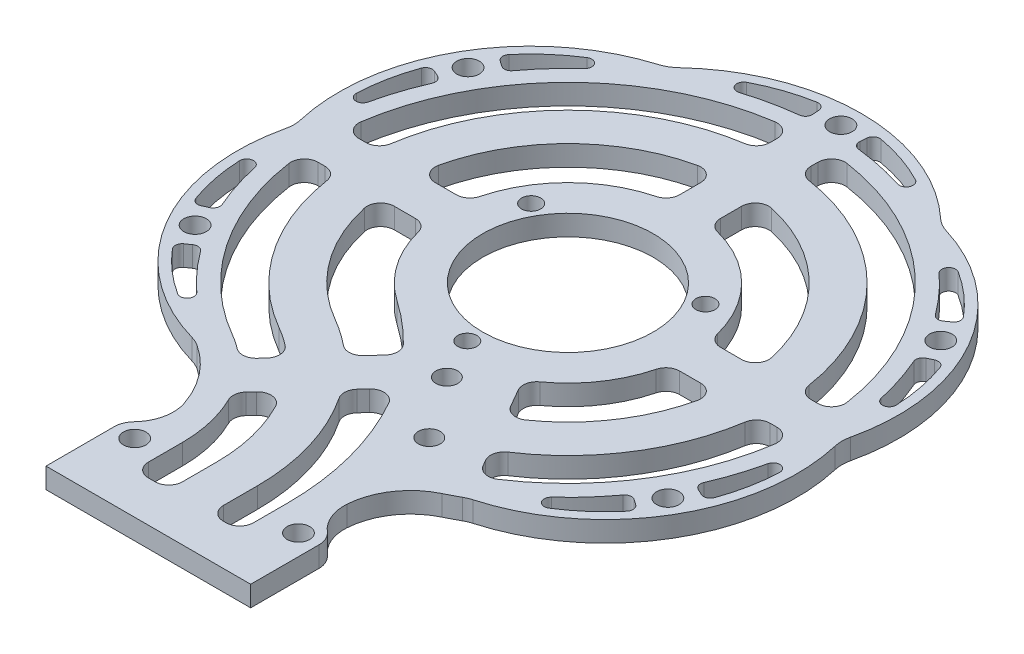
from build123d import *

# Parameters (mm, degrees)
SWEEP_2_DEPTH                   = 3
SKETCH_15_W                     = 3
SKETCH_15_H                     = 8
REVOLVE_1_ANGLE                 = 60
SKETCH_20_R                     = 26.546275206
EXTRUDE_1_DEPTH                 = 3
SKETCH_21_R                     = 12.5
CUT_EXTRUDE_1_DEPTH             = 10
CUT_EXTRUDE_2_REACH             = 65.063
SKETCH_22_R                     = 20
EXTRUDE_START                   = 22
SKETCH_23_R                     = 17
SKETCH_23_R_2                   = 12.5
EXTRUDE_2_DEPTH                 = 22
SKETCH_24_R                     = 55.165528931
CUT_EXTRUDE_3_DEPTH             = 67.603303222
SKETCH_25_R                     = 1.4
CUT_EXTRUDE_4_DEPTH             = 10
SKETCH_26_R                     = 3
EXTRUDE_3_DEPTH                 = 3
SKETCH_27_R                     = 1.4
CUT_EXTRUDE_5_DEPTH             = 3
FILLET_1_R                      = 10
SKETCH_28_R                     = 1.6
CUT_EXTRUDE_6_DEPTH             = 132.370246405
SKETCH_29_W                     = 24
SKETCH_29_H                     = 3
EXTRUDE_4_DEPTH                 = 13
SKETCH_30_R                     = 3
EXTRUDE_5_DEPTH                 = 3
SKETCH_31_R                     = 1.35
CUT_EXTRUDE_7_DEPTH             = 15
FILLET_2_R                      = 6
CUT_EXTRUDE_9_DEPTH             = 10
EXTRUDE_6_DEPTH                 = 3
SKETCH_35_W                     = 6
SKETCH_35_H                     = 18.865237243
EXTRUDE_8_DEPTH                 = 3
SKETCH_36_W                     = 21.70105557
SKETCH_36_H                     = 6
EXTRUDE_9_DEPTH                 = 3
FILLET_3_R                      = 2
FILLET_4_R                      = 2
FILLET_5_R                      = 2
EXTRUDE_10_DEPTH                = 3
FILLET_6_R                      = 2
EXTRUDE_11_DEPTH                = 3
CUT_EXTRUDE_START               = -10
CUT_EXTRUDE_10_DEPTH            = 10
EXTRUDE_START_2                 = -3
EXTRUDE_12_DEPTH                = 3
PATTERN_CIRCULAR_1_COUNT        = 3
PATTERN_CIRCULAR_1_ANGLE        = 120
PATTERN_START                   = -3
PATTERN_CIRCULAR_1_COPY_1_DEPTH = 3
PATTERN_CIRCULAR_1_COPY_2_DEPTH = 3
F_1_THE_OTHER_WAY_COUNT         = 3
F_1_THE_OTHER_WAY_ANGLE         = 120
F_1_START                       = -3
F_1_THE_OTHER_WAY_COPY_1_DEPTH  = 3
F_1_THE_OTHER_WAY_COPY_2_DEPTH  = 3
EXTRUDE_13_DEPTH                = 3
FILLET_8_R                      = 5
FILLET_9_R                      = 5
MM_PRESS_1_D                    = 3.3


# Read off the part's stored shape, not the designer's step: 扫描2
with BuildPart() as part:
    # 扫描2 outline → 扫描2 (new body)
    with BuildSketch(Plane(origin=(0, 0, 0), x_dir=(1, 0, 0), z_dir=(0, 1, 0))):
        with BuildLine():
            ThreePointArc((-20, -34.641016151), (-14.143593539, -40.497422612), (-12, -48.497422612))
            Line((-12, -48.497422612), (12, -48.497422612))
            ThreePointArc((12, -48.497422612), (11.683405538, -43.474741562), (10.738633754, -38.531568163))
            ThreePointArc((10.738633754, -38.531568163), (5.02268105, 39.683405538), (-20, -34.641016151))
        make_face()
        with BuildLine():
            ThreePointArc((0, -19.931708898), (-3.808527847, -16.641925832), (-8, -13.856406461))
            ThreePointArc((-8, -13.856406461), (4.14110472, 15.454813221), (0, -16))
            Line((0, -16), (0, -19.931708898))
        make_face(mode=Mode.SUBTRACT)
    extrude(amount=SWEEP_2_DEPTH)

    # 扫描3: sweep along a path in 草图16
    with BuildLine(Plane(origin=(0, 3, 0), x_dir=(1, 0, 0), z_dir=(0, 1, 0))) as sweep_3_path:
        ThreePointArc((-12, -48.497422612), (-14.143593539, -40.497422612), (-20, -34.641016151))
        ThreePointArc((-20, -34.641016151), (5.02268105, 39.683405538), (10.738633754, -38.531568163))
    # 草图15 → 扫描3 (sweep)
    with BuildSketch(Plane.XY.offset(48.497422612)):
        with Locations((-10.5, 4)):
            Rectangle(SKETCH_15_W, SKETCH_15_H)
    sweep(path=sweep_3_path.line)

    # 草图17 → 旋转1 (revolve)
    with BuildSketch(Plane.XY.offset(48.497422612)):
        Polygon((9, 8), (9, 0), (12, 0), (12, 3), (15, 3), (15, 8), align=None)
    revolve(axis=Axis((-28, 3, 48.497422612), (0, 1, 0)), revolution_arc=REVOLVE_1_ANGLE)

    # 草图20 → 凸台-拉伸1 (add)
    with BuildSketch(Plane(origin=(0, 3, 0), x_dir=(1, 0, 0), z_dir=(0, 1, 0))):
        Circle(SKETCH_20_R)
    extrude(amount=-EXTRUDE_1_DEPTH)

    # 草图21 → 切除-拉伸1 (cut)
    with BuildSketch(Plane(origin=(0, 3, 0), x_dir=(1, 0, 0), z_dir=(0, 1, 0))):
        with Locations(Location((0, 0, 0), (0, 0, 270))):
            Circle(SKETCH_21_R)
    extrude(amount=-CUT_EXTRUDE_1_DEPTH, mode=Mode.SUBTRACT)

    # 草图22 → 切除-拉伸2 (cut, up to next)
    with BuildSketch(Plane(origin=(0, 3, 0), x_dir=(1, 0, 0), z_dir=(0, 1, 0)), mode=Mode.PRIVATE) as cut_extrude_2_sk1:
        Circle(SKETCH_22_R)
    cut_extrude_2_tool1 = extrude(cut_extrude_2_sk1.sketch, amount=CUT_EXTRUDE_2_REACH, mode=Mode.PRIVATE) & part.part
    add(cut_extrude_2_tool1.solids().sort_by_distance((0, 3, 0))[0], mode=Mode.SUBTRACT)

    # 草图23 → 凸台-拉伸2 (add)
    with BuildSketch(Plane(origin=(0, 3, 0), x_dir=(1, 0, 0), z_dir=(0, 1, 0)).offset(EXTRUDE_START)):
        with Locations(Location((0, 0, 0), (0, 0, 270))):
            Circle(SKETCH_23_R)
        with Locations(Location((0, 0, 0), (0, 0, 270))):
            Circle(SKETCH_23_R_2, mode=Mode.SUBTRACT)
    extrude(amount=-EXTRUDE_2_DEPTH)

    # 草图24 → 切除-拉伸3 (cut, through all)
    with BuildSketch(Plane(origin=(0, 3, 0), x_dir=(1, 0, 0), z_dir=(0, 1, 0))):
        Circle(SKETCH_24_R)
    extrude(amount=CUT_EXTRUDE_3_DEPTH, mode=Mode.SUBTRACT)

    # 草图25 → 切除-拉伸4 (cut)
    with BuildSketch(Plane(origin=(0, 3, 0), x_dir=(1, 0, 0), z_dir=(0, 1, 0))):
        with Locations(Location((0, -14.75, 0), (0, 0, 270))):
            Circle(SKETCH_25_R)
        with Locations(Location((-12.773874706, 7.375, 0), (0, 0, 270))):
            Circle(SKETCH_25_R)
        with Locations(Location((12.773874706, 7.375, 0), (0, 0, 270))):
            Circle(SKETCH_25_R)
    extrude(amount=-CUT_EXTRUDE_4_DEPTH, mode=Mode.SUBTRACT)

    # 草图26 → 凸台-拉伸3 (add)
    with BuildSketch(Plane(origin=(0, 3, 0), x_dir=(1, 0, 0), z_dir=(0, 1, 0))):
        with Locations((0, 40)):
            Circle(SKETCH_26_R)
        with Locations((34.641016151, 20)):
            Circle(SKETCH_26_R)
        with Locations((34.641016151, -20)):
            Circle(SKETCH_26_R)
        with Locations((0, -40)):
            Circle(SKETCH_26_R)
        with Locations((-34.641016151, -20)):
            Circle(SKETCH_26_R)
        with Locations((-34.641016151, 20)):
            Circle(SKETCH_26_R)
    extrude(amount=-EXTRUDE_3_DEPTH)

    # 草图27 → 切除-拉伸5 (cut)
    with BuildSketch(Plane(origin=(0, 3, 0), x_dir=(1, 0, 0), z_dir=(0, 1, 0))):
        with Locations(Location((0, 40, 0), (0, 0, 270))):
            Circle(SKETCH_27_R)
        with Locations(Location((34.641016151, 20, 0), (0, 0, 270))):
            Circle(SKETCH_27_R)
        with Locations(Location((34.641016151, -20, 0), (0, 0, 270))):
            Circle(SKETCH_27_R)
        with Locations(Location((-34.641016151, -20, 0), (0, 0, 270))):
            Circle(SKETCH_27_R)
        with Locations(Location((-34.641016151, 20, 0), (0, 0, 270))):
            Circle(SKETCH_27_R)
    extrude(amount=-CUT_EXTRUDE_5_DEPTH, mode=Mode.SUBTRACT)

    # 圆角1
    fillet_1_edges = [part.edges().sort_by_distance(p)[0] for p in [
        (10.738633754, 1.5, 38.531568163),
    ]]
    fillet(fillet_1_edges, radius=FILLET_1_R)

    # 草图28 → 切除-拉伸6 (cut, through all)
    with BuildSketch(Plane(origin=(81.194664378, 11, -0.989898296), x_dir=(0.3228039028312254, 0, 0.9464658685430388), z_dir=(0, 1, 0))):
        with Locations(Location((5.99382266, -77.812125081, 0), (0, 0, 341.167421925))):
            Circle(SKETCH_28_R)
        with Locations(Location((-4.545358519, -80.962626641, 0), (0, 0, 341.167421925))):
            Circle(SKETCH_28_R)
    extrude(amount=-CUT_EXTRUDE_6_DEPTH, mode=Mode.SUBTRACT)

    # 草图29 → 凸台-拉伸4 (add)
    with BuildSketch(Plane.XY.offset(48.497422612)):
        with Locations((0, 1.5)):
            Rectangle(SKETCH_29_W, SKETCH_29_H)
    extrude(amount=EXTRUDE_4_DEPTH)

    # 草图30 → 凸台-拉伸5 (add)
    with BuildSketch(Plane(origin=(0, 3, 0), x_dir=(1, 0, 0), z_dir=(0, 1, 0))):
        with Locations((12, -51.497422612)):
            Circle(SKETCH_30_R)
        with BuildLine():
            ThreePointArc((-12, -54.497422612), (-9.878679656, -53.618742955), (-9, -51.497422612))
            ThreePointArc((-9, -51.497422612), (-9.878679656, -49.376102268), (-12, -48.497422612))
            Line((-12, -48.497422612), (-12, -54.497422612))
        make_face()
        with BuildLine():
            Line((-12, -54.497422612), (-12, -48.497422612))
            ThreePointArc((-12, -48.497422612), (-15, -51.497422612), (-12, -54.497422612))
        make_face()
        with BuildLine():
            ThreePointArc((12, -54.497422612), (14.121320344, -53.618742955), (15, -51.497422612))
            ThreePointArc((15, -51.497422612), (14.121320344, -49.376102268), (12, -48.497422612))
            Line((12, -48.497422612), (12, -54.497422612))
        make_face()
        with BuildLine():
            Line((12, -54.497422612), (12, -48.497422612))
            ThreePointArc((12, -48.497422612), (9, -51.497422612), (12, -54.497422612))
        make_face()
    extrude(amount=-EXTRUDE_5_DEPTH)

    # 草图31 → 切除-拉伸7 (cut)
    with BuildSketch(Plane.XZ):
        with Locations(Location((-12, 51.497422612, 0), (0, 0, 270))):
            Circle(SKETCH_31_R)
        with Locations(Location((12, 51.497422612, 0), (0, 0, 270))):
            Circle(SKETCH_31_R)
    extrude(amount=-CUT_EXTRUDE_7_DEPTH, mode=Mode.SUBTRACT)

    # 圆角2
    # the kernel refuses this fillet: 6 mm, written as the material it adds along each edge
    with BuildSketch(Plane(origin=(-12, 0, 48.497422612), x_dir=(-0.9188891205468253, 0, 0.3945158857900176), z_dir=(0, 1, 0))) as fillet_2_piece_1:
        with BuildLine():
            CenterArc((4.73419063, -5.513334723), FILLET_2_R, 113.235784524, 62.181860715)
            ThreePointArc((-1.246630549, -5.033983053), (-0.828629151, -2.466146987), (0, 0))
            ThreePointArc((0, 0), (1.183547657, -0.243332638), (2.367095315, 0))
        make_face()
    extrude(amount=3)
    with BuildSketch(Plane(origin=(33.044643352, 3, -22.539998797), x_dir=(0.9763333982602803, 0, -0.21627088440549028), z_dir=(0, -1, 0)), Plane(origin=(36.042533235, 3, 17.347501204), x_dir=(0.6754627791459785, 0, 0.7373940832339184), z_dir=(0, -1, 0))) as fillet_2_piece_2:
        with BuildLine():
            CenterArc((4.037057174, -5.650269228), FILLET_2_R, 109.658997639, 43.86169752)
            ThreePointArc((-1.333515642, -2.975022018), (-0.636435164, -1.501102753), (0, 0))
            ThreePointArc((0, 0), (1.009264294, -0.174865386), (2.018528587, 0))
        make_face()
    extrude(amount=3)
    with BuildSketch(Plane(origin=(36.042533235, 3, -17.347501204), x_dir=(0.3966064660544948, 0, 0.9179887314579438), z_dir=(0, -1, 0)), Plane(origin=(33.044643352, 3, 22.539998797), x_dir=(-0.5966983288141339, 0, 0.8024656406291921), z_dir=(0, -1, 0)), Plane(origin=(2.997889883, 3, -39.8875), x_dir=(0.9933047948584526, 0, 0.11552309081394699), z_dir=(0, -1, 0))) as fillet_2_piece_3:
        with BuildLine():
            CenterArc((3.504734114, -5.995015577), FILLET_2_R, 92.335605783, 43.86169752)
            ThreePointArc((-0.825631791, -1.841952715), (-0.253247299, -0.992500944), (0, 0))
            ThreePointArc((0, 0), (1.63010889, -0.03322949), (3.26021778, 0))
        make_face()
    extrude(amount=3)
    with BuildSketch(Plane(origin=(-2.997889883, 3, -39.8875), x_dir=(0.30087061904832696, 0, -0.9536649676870157), z_dir=(0, -1, 0))) as fillet_2_piece_4:
        with BuildLine():
            CenterArc((4.037057174, -5.650269227), FILLET_2_R, 109.65899764, 43.861697522)
            ThreePointArc((-1.333515641, -2.975022018), (-0.636435164, -1.501102753), (0, 0))
            ThreePointArc((0, 0), (1.009264294, -0.174865386), (2.018528587, 0))
        make_face()
    extrude(amount=3)
    with BuildSketch(Plane(origin=(-36.042533235, 3, -17.347501204), x_dir=(-0.3966064660363216, 0, 0.9179887314657953), z_dir=(0, -1, 0))) as fillet_2_piece_5:
        with BuildLine():
            CenterArc((3.504734114, 5.995015577), FILLET_2_R, 223.80269669, 43.861697526)
            ThreePointArc((-0.82563179, 1.841952715), (-0.253247299, 0.992500944), (0, 0))
            ThreePointArc((0, 0), (1.63010889, 0.03322949), (3.260217781, 0))
        make_face()
    extrude(amount=3)
    with BuildSketch(Plane(origin=(-33.044643352, 3, -22.539998796), x_dir=(-0.9763333982183507, 0, -0.2162708845947773), z_dir=(0, -1, 0))) as fillet_2_piece_6:
        with BuildLine():
            CenterArc((4.037057175, 5.650269227), FILLET_2_R, 206.479304831, 43.861697526)
            ThreePointArc((-1.333515641, 2.975022019), (-0.636435164, 1.501102753), (0, 0))
            ThreePointArc((0, 0), (1.009264294, 0.174865386), (2.018528587, 0))
        make_face()
    extrude(amount=3)
    with BuildSketch(Plane(origin=(-33.044643352, 3, 22.539998796), x_dir=(0.5966983288105701, 0, 0.8024656406318421), z_dir=(0, -1, 0))) as fillet_2_piece_7:
        with BuildLine():
            CenterArc((3.504734114, 5.995015577), FILLET_2_R, 223.802696689, 43.861697528)
            ThreePointArc((-0.82563179, 1.841952715), (-0.253247299, 0.992500944), (0, 0))
            ThreePointArc((0, 0), (1.63010889, 0.03322949), (3.260217781, 0))
        make_face()
    extrude(amount=3)
    with BuildSketch(Plane(origin=(-36.042533235, 3, 17.347501203), x_dir=(-0.6754627793068153, 0, 0.7373940830865899), z_dir=(0, -1, 0))) as fillet_2_piece_8:
        with BuildLine():
            CenterArc((4.037057175, 5.650269227), FILLET_2_R, 206.479304829, 43.861697528)
            ThreePointArc((-1.333515641, 2.975022019), (-0.636435164, 1.501102753), (0, 0))
            ThreePointArc((0, 0), (1.009264294, 0.174865386), (2.018528588, 0))
        make_face()
    extrude(amount=3)
    with BuildSketch(Plane(origin=(-12, 3, 54.497422612), x_dir=(0, 0, 1), z_dir=(0, -1, 0)), Plane(origin=(12, 0, 54.497422612), x_dir=(0, 0, 1), z_dir=(0, 1, 0))) as fillet_2_piece_9:
        with BuildLine():
            CenterArc((3.708203932, 6), FILLET_2_R, 221.810314896, 48.189685104)
            ThreePointArc((-0.763932023, 2), (-0.197482923, 1.070466269), (0, 0))
            Line((0, 0), (3.708203932, 0))
        make_face()
    extrude(amount=3)
    with BuildSketch(Plane(origin=(12, 0, 48.497422612), x_dir=(0.9371957750043066, 0, 0.3488037833998896), z_dir=(0, 1, 0))) as fillet_2_piece_10:
        with BuildLine():
            CenterArc((4.185645401, 5.62317465), FILLET_2_R, 196.491348694, 53.09448469)
            Line((-1.56753025, 3.919951256), (-2.142847815, 3.749628917))
            ThreePointArc((-2.142847815, 3.749628917), (-1.626796654, 2.367965564), (-0.562317465, -0.20928227))
            Line((-0.562317465, -0.20928227), (0.20928227, -0.562317465))
            ThreePointArc((0.20928227, -0.562317465), (1.04641135, -0.411587325), (1.88354043, -0.562317465))
            Line((1.88354043, -0.562317465), (2.092822701, 0))
        make_face()
    extrude(amount=3)

    # 草图32 → 切除-拉伸9 (cut)
    with BuildSketch(Plane.XZ):
        with BuildLine():
            Line((-8, 61.497422612), (-8, 48.497422612))
            ThreePointArc((-8, 48.497422612), (-10.679492111, 38.497422289), (-18.000000645, 31.176914164))
            ThreePointArc((-18.000000645, 31.176914164), (3.72e-07, -36), (18, 31.176914536))
            Line((18, 31.176914536), (15.5, 26.846787517))
            ThreePointArc((15.5, 26.846787517), (-2.81e-07, -31), (-15.499999514, 26.846787798))
            ThreePointArc((-15.499999514, 26.846787798), (-6.349364765, 35.997422855), (-3, 48.497422612))
            Line((-3, 48.497422612), (-3, 61.497422612))
            Line((-3, 61.497422612), (-8, 61.497422612))
        make_face()
        with BuildLine():
            Line((3, 61.497422612), (3, 48.497422612))
            ThreePointArc((3, 48.497422612), (-1.153212653, 32.997422318), (-12.500000589, 21.650634755))
            ThreePointArc((-12.500000589, 21.650634755), (3.4e-07, -25), (12.5, 21.650635095))
            Line((12.5, 21.650635095), (9, 15.588457268))
            ThreePointArc((9, 15.588457268), (0.739708837, -17.984794434), (-10.249732693, 14.796721925))
            ThreePointArc((-10.249732693, 14.796721925), (-3.462921106, 20.698035366), (1.87377597, 27.937232569))
            ThreePointArc((1.87377597, 27.937232569), (5.995910609, 37.85219006), (7.40211114, 48.497422612))
            Line((7.40211114, 48.497422612), (7.40211114, 61.497422612))
            Line((7.40211114, 61.497422612), (3, 61.497422612))
        make_face()
    extrude(amount=-CUT_EXTRUDE_9_DEPTH, mode=Mode.SUBTRACT)

    # 草图33 → 凸台-拉伸6 (add)
    with BuildSketch(Plane.XZ):
        with BuildLine():
            Line((39.88734135, 3), (17.499825783, 3))
            Line((17.499825783, 3), (17.499825783, -3))
            Line((17.499825783, -3), (39.88734135, -3))
            ThreePointArc((39.88734135, -3), (40, 0), (39.88734135, 3))
        make_face()
        with BuildLine():
            Line((-16.469785879, -3), (-16.469785879, 3))
            Line((-16.469785879, 3), (-39.88734135, 3))
            ThreePointArc((-39.88734135, 3), (-40, 0), (-39.88734135, -3))
            Line((-39.88734135, -3), (-16.469785879, -3))
        make_face()
    extrude(amount=-EXTRUDE_6_DEPTH)

    # 草图35 → 凸台-拉伸8 (add)
    with BuildSketch(Plane.XZ):
        with Locations((0, -26.567381379)):
            Rectangle(SKETCH_35_W, SKETCH_35_H)
    extrude(amount=-EXTRUDE_8_DEPTH)

    # 草图36 → 凸台-拉伸9 (add)
    with BuildSketch(Plane.XZ):
        with Locations((-1.149472215, 58.497422612)):
            Rectangle(SKETCH_36_W, SKETCH_36_H)
    extrude(amount=-EXTRUDE_9_DEPTH)

    # 圆角3
    fillet_3_edges = [part.edges().sort_by_distance(p)[0] for p in [
        (15.5, 1.5, 26.846787517),
        (18, 1.5, 31.176914536),
        (9, 1.5, 15.588457268),
        (12.5, 1.5, 21.650635095),
        (35.874782229, 1.5, 3),
        (17.748239349, 1.5, 3),
        (3, 1.5, -35.874782229),
        (3, 1.5, -17.748239349),
        (3, 1.5, -24.819347292),
        (3, 1.5, -30.854497241),
    ]]
    fillet(fillet_3_edges, radius=FILLET_3_R)

    # 圆角4
    fillet_4_edges = [part.edges().sort_by_distance(p)[0] for p in [
        (35.874782229, 1.5, -3),
        (24.819347292, 1.5, 3),
        (30.854497241, 1.5, 3),
        (17.748239349, 1.5, -3),
        (24.819347292, 1.5, -3),
        (30.854497241, 1.5, -3),
    ]]
    fillet(fillet_4_edges, radius=FILLET_4_R)

    # 圆角5
    fillet_5_edges = [part.edges().sort_by_distance(p)[0] for p in [
        (-35.874782229, 1.5, 3),
        (-35.874782229, 1.5, -3),
        (-17.748239349, 1.5, -3),
        (-30.854497241, 1.5, -3),
        (-17.748239349, 1.5, 3),
        (-24.819347292, 1.5, 3),
        (-30.854497241, 1.5, 3),
        (-3, 1.5, -35.874782229),
        (-3, 1.5, -17.748239349),
        (-3, 1.5, -24.819347292),
        (-3, 1.5, -30.854497241),
        (-3, 1.5, 55.497422612),
        (3, 1.5, 55.497422612),
        (-8, 1.5, 55.497422612),
        (7.40211114, 1.5, 55.497422612),
    ]]
    fillet(fillet_5_edges, radius=FILLET_5_R)

    # 草图37 → 凸台-拉伸10 (add)
    with BuildSketch(Plane.XZ):
        Polygon((-17.191931218, 36.699725836), (-3, 21.208327275), (-1.79529849, 20.206903031), (2.3744846, 24.37668612), (0.706807475, 26.044363245), (-12.767794927, 40.752751629), align=None)
    extrude(amount=-EXTRUDE_10_DEPTH)

    # 圆角6
    fillet_6_edges = [part.edges().sort_by_distance(p)[0] for p in [
        (-7.181832233, 1.5, 34.655316889),
        (-11.112392529, 1.5, 30.0635214),
        (-7.059366736, 1.5, 25.639385109),
        (-14.489914023, 1.5, 33.750301642),
        (-3.031202519, 1.5, 30.124639689),
        (-10.688063081, 1.5, 38.482591604),
        (-3, 1.5, 21.208327275),
        (0.706807475, 1.5, 26.044363245),
        (-24.819347292, 1.5, -3),
    ]]
    fillet(fillet_6_edges, radius=FILLET_6_R)

    # 草图38 → 凸台-拉伸11 (add)
    with BuildSketch(Plane.XZ):
        with BuildLine():
            ThreePointArc((-38.003850346, 16.519421106), (-37.60034262, 17.023161048), (-36.97314919, 17.175479189))
            ThreePointArc((-36.97314919, 17.175479189), (-37.129894662, 18.021268737), (-37.405974164, 18.83595224))
            ThreePointArc((-37.405974164, 18.83595224), (-37.635147351, 20.187558954), (-37.239092362, 21.500000001))
            ThreePointArc((-37.239092362, 21.500000001), (-40.775652835, 11.026874946), (-40, 0))
            ThreePointArc((-40, 0), (-39.971825415, 1.501057292), (-39.88734135, 3))
            ThreePointArc((-39.88734135, 3), (-39.747395065, 4.488271997), (-39.551938102, 5.970275733))
            ThreePointArc((-39.551938102, 5.970275733), (-39.309944352, 11.32292681), (-38.003850346, 16.519421106))
        make_face()
        with BuildLine():
            ThreePointArc((-20, 34.641016151), (-29.937380244, 29.799313739), (-37.239092362, 21.500000001))
            ThreePointArc((-37.239092362, 21.500000001), (-36.300512569, 22.499214205), (-35.015400227, 22.976547759))
            ThreePointArc((-35.015400227, 22.976547759), (-34.171823866, 23.144797649), (-33.360975895, 23.431946861))
            ThreePointArc((-33.360975895, 23.431946861), (-33.54266123, 24.051271376), (-33.308163506, 24.652589288))
            ThreePointArc((-33.308163506, 24.652589288), (-29.460914439, 28.381947026), (-24.946379504, 31.267845299))
            ThreePointArc((-24.946379504, 31.267845299), (-22.536388975, 33.047105349), (-20, 34.641016151))
        make_face()
        with BuildLine():
            ThreePointArc((-39.88734135, -3), (-39.971825415, -1.501057292), (-40, 0))
            ThreePointArc((-40, 0), (-40.775652576, -11.026876966), (-37.239090326, -21.500003528))
            ThreePointArc((-37.239090326, -21.500003528), (-37.635147223, -20.187560986), (-37.405974164, -18.83595224))
            ThreePointArc((-37.405974164, -18.83595224), (-37.129894662, -18.021268737), (-36.97314919, -17.175479189))
            ThreePointArc((-36.97314919, -17.175479189), (-37.60034262, -17.023161048), (-38.003850346, -16.519421106))
            ThreePointArc((-38.003850346, -16.519421106), (-39.309944352, -11.32292681), (-39.551938102, -5.970275733))
            ThreePointArc((-39.551938102, -5.970275733), (-39.747395065, -4.488271997), (-39.88734135, -3))
        make_face()
        with BuildLine():
            ThreePointArc((-35.015400227, -22.976547759), (-36.300510872, -22.499215331), (-37.239090326, -21.500003528))
            ThreePointArc((-37.239090326, -21.500003528), (-29.937378625, -29.799314973), (-20, -34.641016151))
            ThreePointArc((-20, -34.641016151), (-22.536388975, -33.047105349), (-24.946379505, -31.267845298))
            ThreePointArc((-24.946379505, -31.267845298), (-29.460914439, -28.381947025), (-33.308163506, -24.652589288))
            ThreePointArc((-33.308163506, -24.652589288), (-33.54266123, -24.051271376), (-33.360975895, -23.431946862))
            ThreePointArc((-33.360975895, -23.431946862), (-34.171823866, -23.144797649), (-35.015400227, -22.976547759))
        make_face()
        with BuildLine():
            ThreePointArc((-14.605558596, -37.238121033), (-17.351438265, -36.040638037), (-20, -34.641016151))
            ThreePointArc((-20, -34.641016151), (-10.83827259, -40.826188684), (0, -43))
            ThreePointArc((0, -43), (-1.334634781, -42.686773158), (-2.390573937, -41.8125))
            ThreePointArc((-2.390573937, -41.8125), (-2.958070796, -41.166066386), (-3.612173295, -40.607426051))
            ThreePointArc((-3.612173295, -40.607426051), (-4.05768139, -41.074432424), (-4.69568684, -41.172010394))
            ThreePointArc((-4.69568684, -41.172010394), (-9.849029913, -39.704873836), (-14.605558596, -37.238121033))
        make_face()
        with BuildLine():
            ThreePointArc((2.390573937, -41.8125), (1.334634781, -42.686773158), (0, -43))
            ThreePointArc((0, -43), (10.838272591, -40.826188684), (20, -34.641016151))
            ThreePointArc((20, -34.641016152), (17.351438265, -36.040638038), (14.605558595, -37.238121034))
            ThreePointArc((14.605558595, -37.238121034), (9.849029912, -39.704873836), (4.69568684, -41.172010394))
            ThreePointArc((4.69568684, -41.172010394), (4.05768139, -41.074432424), (3.612173295, -40.607426051))
            ThreePointArc((3.612173295, -40.607426051), (2.958070796, -41.166066386), (2.390573937, -41.8125))
        make_face()
        with BuildLine():
            ThreePointArc((24.946379507, -31.267845297), (22.536388977, -33.047105349), (20, -34.641016152))
            ThreePointArc((20, -34.641016151), (29.937380296, -29.7993137), (37.239092427, -21.499999889))
            ThreePointArc((37.239092427, -21.499999889), (36.300512623, -22.499214169), (35.015400227, -22.976547759))
            ThreePointArc((35.015400227, -22.976547759), (34.171823866, -23.144797649), (33.360975895, -23.431946862))
            ThreePointArc((33.360975895, -23.431946862), (33.54266123, -24.051271376), (33.308163506, -24.652589288))
            ThreePointArc((33.308163506, -24.652589288), (29.46091444, -28.381947025), (24.946379507, -31.267845297))
        make_face()
        with BuildLine():
            ThreePointArc((37.405974165, -18.835952241), (37.635147355, -20.187558889), (37.239092427, -21.499999889))
            ThreePointArc((37.239092427, -21.499999889), (40.775652843, -11.026874882), (40, 0))
            ThreePointArc((40, 0), (39.971825415, -1.501057292), (39.88734135, -3))
            ThreePointArc((39.887341351, -3), (39.747395066, -4.488271999), (39.551938103, -5.970275737))
            ThreePointArc((39.551938103, -5.970275737), (39.309944352, -11.322926812), (38.003850346, -16.519421106))
            ThreePointArc((38.003850346, -16.519421106), (37.60034262, -17.023161048), (36.97314919, -17.175479189))
            ThreePointArc((36.97314919, -17.175479189), (37.129894663, -18.021268737), (37.405974165, -18.835952241))
        make_face()
        with BuildLine():
            ThreePointArc((37.239092321, 21.500000073), (29.937380211, 29.799313764), (20, 34.641016151))
            ThreePointArc((20, 34.641016152), (22.536388976, 33.047105349), (24.946379506, 31.267845298))
            ThreePointArc((24.946379506, 31.267845298), (29.46091444, 28.381947025), (33.308163506, 24.652589288))
            ThreePointArc((33.308163506, 24.652589288), (33.54266123, 24.051271376), (33.360975895, 23.431946862))
            ThreePointArc((33.360975895, 23.431946862), (34.171823866, 23.144797649), (35.015400227, 22.976547759))
            ThreePointArc((35.015400227, 22.976547759), (36.300512534, 22.499214227), (37.239092321, 21.500000073))
        make_face()
        with BuildLine():
            ThreePointArc((39.88734135, 3), (39.971825415, 1.501057292), (40, 0))
            ThreePointArc((40, 0), (40.77565283, 11.026874987), (37.239092321, 21.500000073))
            ThreePointArc((37.239092321, 21.500000073), (37.635147348, 20.187558995), (37.405974165, 18.835952241))
            ThreePointArc((37.405974165, 18.835952241), (37.129894663, 18.021268737), (36.97314919, 17.17547919))
            ThreePointArc((36.97314919, 17.17547919), (37.60034262, 17.023161048), (38.003850346, 16.519421106))
            ThreePointArc((38.003850346, 16.519421106), (39.309944352, 11.322926812), (39.551938103, 5.970275737))
            ThreePointArc((39.551938103, 5.970275737), (39.747395066, 4.488271999), (39.887341351, 3))
        make_face()
    extrude(amount=-EXTRUDE_11_DEPTH)

    # 草图39 → 切除-拉伸10 (cut)
    with BuildSketch(Plane(origin=(0, 3, 0), x_dir=(1, 0, 0), z_dir=(0, 1, 0)).offset(CUT_EXTRUDE_START)):
        with BuildLine():
            Line((-32.346135074, -22.649007611), (-33.117172331, -23.18889371))
            ThreePointArc((-33.117172331, -23.18889371), (-33.535189843, -23.878657037), (-33.308163506, -24.652589288))
            ThreePointArc((-33.308163506, -24.652589288), (-28.772660719, -28.908509361), (-23.375407491, -31.999350474))
            ThreePointArc((-23.375407491, -31.999350474), (-22.923031122, -32.077790693), (-22.483282408, -31.94581223))
            ThreePointArc((-22.483282408, -31.94581223), (-22.539584005, -31.401415457), (-22.874029031, -30.968190065))
            ThreePointArc((-22.874029031, -30.968190065), (-27.223611076, -27.223611076), (-30.968190065, -22.874029031))
            ThreePointArc((-30.968190065, -22.874029031), (-31.611391295, -22.481232562), (-32.346135074, -22.649007611))
        make_face()
        with BuildLine():
            ThreePointArc((-38.256253821, -4.325395195), (-37.188144312, -9.964533236), (-35.29358526, -15.38222479))
            ThreePointArc((-35.29358526, -15.38222479), (-35.275014154, -16.135651629), (-35.787683499, -16.688070883))
            Line((-35.787683499, -16.688070883), (-36.640757204, -17.085865685))
            ThreePointArc((-36.640757204, -17.085865685), (-37.447118524, -17.102997807), (-38.003850346, -16.519421106))
            ThreePointArc((-38.003850346, -16.519421106), (-39.421833851, -10.463600437), (-39.399954161, -4.244021474))
            ThreePointArc((-39.399954161, -4.244021474), (-39.241697198, -3.813031937), (-38.907526139, -3.498187611))
            ThreePointArc((-38.907526139, -3.498187611), (-38.464215503, -3.81914461), (-38.256253821, -4.325395195))
        make_face()
        with BuildLine():
            Line((-35.787683499, 16.688070883), (-36.640757204, 17.085865685))
            ThreePointArc((-36.640757204, 17.085865685), (-37.447118524, 17.102997807), (-38.003850346, 16.519421106))
            ThreePointArc((-38.003850346, 16.519421106), (-39.421833851, 10.463600437), (-39.399954161, 4.244021474))
            ThreePointArc((-39.399954161, 4.244021474), (-39.241697198, 3.813031937), (-38.907526139, 3.498187611))
            ThreePointArc((-38.907526139, 3.498187611), (-38.464215503, 3.81914461), (-38.256253821, 4.325395195))
            ThreePointArc((-38.256253821, 4.325395195), (-37.188144312, 9.964533236), (-35.29358526, 15.38222479))
            ThreePointArc((-35.29358526, 15.38222479), (-35.275014154, 16.135651629), (-35.787683499, 16.688070883))
        make_face()
        with BuildLine():
            ThreePointArc((-22.874029031, 30.968190065), (-27.223611076, 27.223611076), (-30.968190065, 22.874029031))
            ThreePointArc((-30.968190065, 22.874029031), (-31.611391295, 22.481232562), (-32.346135074, 22.649007611))
            Line((-32.346135074, 22.649007611), (-33.117172331, 23.18889371))
            ThreePointArc((-33.117172331, 23.18889371), (-33.535189843, 23.878657037), (-33.308163506, 24.652589288))
            ThreePointArc((-33.308163506, 24.652589288), (-28.772660719, 28.908509361), (-23.375407491, 31.999350474))
            ThreePointArc((-23.375407491, 31.999350474), (-22.923031122, 32.077790693), (-22.483282408, 31.94581223))
            ThreePointArc((-22.483282408, 31.94581223), (-22.539584004, 31.401415457), (-22.874029031, 30.968190065))
        make_face()
        with BuildLine():
            Line((-3.441548424, 39.337078494), (-3.523584873, 40.274759395))
            ThreePointArc((-3.523584873, 40.274759395), (-3.91192868, 40.981654844), (-4.69568684, 41.172010394))
            ThreePointArc((-4.69568684, 41.172010394), (-10.649173132, 39.372109797), (-16.02454667, 36.243371948))
            ThreePointArc((-16.02454667, 36.243371948), (-16.318666076, 35.89082263), (-16.424243732, 35.44399984))
            ThreePointArc((-16.424243732, 35.44399984), (-15.924631498, 35.220560067), (-15.38222479, 35.29358526))
            ThreePointArc((-15.38222479, 35.29358526), (-9.964533236, 37.188144312), (-4.325395195, 38.256253821))
            ThreePointArc((-4.325395195, 38.256253821), (-3.66362286, 38.616884191), (-3.441548424, 39.337078494))
        make_face()
        with BuildLine():
            ThreePointArc((15.38222479, 35.29358526), (9.964533236, 37.188144312), (4.325395195, 38.256253821))
            ThreePointArc((4.325395195, 38.256253821), (3.66362286, 38.616884191), (3.441548424, 39.337078494))
            Line((3.441548424, 39.337078494), (3.523584873, 40.274759395))
            ThreePointArc((3.523584873, 40.274759395), (3.91192868, 40.981654843), (4.69568684, 41.172010394))
            ThreePointArc((4.69568684, 41.172010394), (10.649173132, 39.372109797), (16.02454667, 36.243371948))
            ThreePointArc((16.02454667, 36.243371948), (16.318666076, 35.89082263), (16.424243732, 35.44399984))
            ThreePointArc((16.424243732, 35.44399984), (15.924631498, 35.220560067), (15.38222479, 35.29358526))
        make_face()
        with BuildLine():
            Line((32.346135074, 22.649007611), (33.117172331, 23.18889371))
            ThreePointArc((33.117172331, 23.18889371), (33.535189843, 23.878657037), (33.308163506, 24.652589288))
            ThreePointArc((33.308163506, 24.652589288), (28.772660719, 28.908509361), (23.375407491, 31.999350474))
            ThreePointArc((23.375407491, 31.999350474), (22.923031122, 32.077790693), (22.483282408, 31.94581223))
            ThreePointArc((22.483282408, 31.94581223), (22.539584005, 31.401415457), (22.874029031, 30.968190065))
            ThreePointArc((22.874029031, 30.968190065), (27.223611076, 27.223611076), (30.968190065, 22.874029031))
            ThreePointArc((30.968190065, 22.874029031), (31.611391295, 22.481232562), (32.346135074, 22.649007611))
        make_face()
        with BuildLine():
            ThreePointArc((38.256253821, 4.325395195), (37.188144312, 9.964533236), (35.29358526, 15.38222479))
            ThreePointArc((35.29358526, 15.38222479), (35.275014154, 16.135651629), (35.787683499, 16.688070883))
            Line((35.787683499, 16.688070883), (36.640757204, 17.085865685))
            ThreePointArc((36.640757204, 17.085865685), (37.447118524, 17.102997807), (38.003850346, 16.519421106))
            ThreePointArc((38.003850346, 16.519421106), (39.421833851, 10.463600437), (39.399954161, 4.244021474))
            ThreePointArc((39.399954161, 4.244021474), (39.241697198, 3.813031937), (38.907526139, 3.498187611))
            ThreePointArc((38.907526139, 3.498187611), (38.464215503, 3.81914461), (38.256253821, 4.325395195))
        make_face()
        with BuildLine():
            ThreePointArc((22.874029031, -30.968190065), (27.223611076, -27.223611076), (30.968190065, -22.874029031))
            ThreePointArc((30.968190065, -22.874029031), (31.611391295, -22.481232562), (32.346135074, -22.649007611))
            Line((32.346135074, -22.649007611), (33.117172331, -23.18889371))
            ThreePointArc((33.117172331, -23.18889371), (33.535189843, -23.878657037), (33.308163506, -24.652589288))
            ThreePointArc((33.308163506, -24.652589288), (28.772660719, -28.908509361), (23.375407491, -31.999350474))
            ThreePointArc((23.375407491, -31.999350474), (22.923031122, -32.077790693), (22.483282408, -31.94581223))
            ThreePointArc((22.483282408, -31.94581223), (22.539584004, -31.401415457), (22.874029031, -30.968190065))
        make_face()
        with BuildLine():
            Line((35.787683499, -16.688070883), (36.640757204, -17.085865685))
            ThreePointArc((36.640757204, -17.085865685), (37.447118524, -17.102997807), (38.003850346, -16.519421106))
            ThreePointArc((38.003850346, -16.519421106), (39.421833851, -10.463600437), (39.399954161, -4.244021474))
            ThreePointArc((39.399954161, -4.244021474), (39.241697198, -3.813031937), (38.907526139, -3.498187611))
            ThreePointArc((38.907526139, -3.498187611), (38.464215503, -3.81914461), (38.256253821, -4.325395195))
            ThreePointArc((38.256253821, -4.325395195), (37.188144312, -9.964533236), (35.29358526, -15.38222479))
            ThreePointArc((35.29358526, -15.38222479), (35.275014154, -16.135651629), (35.787683499, -16.688070883))
        make_face()
    extrude(amount=CUT_EXTRUDE_10_DEPTH, mode=Mode.SUBTRACT)

    # 草图41 → 凸台-拉伸12 (add)
    with BuildSketch(Plane(origin=(0, 3, 0), x_dir=(1, 0, 0), z_dir=(0, 1, 0)).offset(EXTRUDE_START_2)):
        with BuildLine():
            ThreePointArc((-15.38222479, 35.29358526), (-13.512795781, 36.050719135), (-11.606281074, 36.708912264))
            ThreePointArc((-11.606281074, 36.708912264), (-12.831107826, 37.278448725), (-12.37120076, 38.548510866))
            ThreePointArc((-12.37120076, 38.548510866), (-14.244579122, 37.469963415), (-16.02454667, 36.243371948))
            ThreePointArc((-16.02454667, 36.243371948), (-16.318666076, 35.89082263), (-16.424243732, 35.44399984))
            ThreePointArc((-16.424243732, 35.44399984), (-15.924631498, 35.220560067), (-15.38222479, 35.29358526))
        make_face()
    extrude_12 = extrude(amount=EXTRUDE_12_DEPTH)

    # 镜向1: 凸台-拉伸12 across plane
    add(extrude_12.mirror(Plane(origin=(0, 0, 0), x_dir=(0, 0, 1), z_dir=(1, 0, 0))))

    # 阵列(圆周)1: 凸台-拉伸12 ×3 about axis
    pattern_circular_1_axis = Axis((0, 0, 0), (0, -1, 0))
    for i in range(1, PATTERN_CIRCULAR_1_COUNT):
        add(extrude_12.rotate(pattern_circular_1_axis, i * PATTERN_CIRCULAR_1_ANGLE / (PATTERN_CIRCULAR_1_COUNT - 1)))

    # 阵列(圆周)1 copy 1 sketch → 阵列(圆周)1 copy 1 (add)
    with BuildSketch(Plane(origin=(0, 3, 0), x_dir=(-0.4999999999999978, 0, -0.8660254037844399), z_dir=(0, 1, 0)).offset(PATTERN_START)):
        with BuildLine():
            ThreePointArc((-15.38222479, -35.29358526), (-13.512795781, -36.050719135), (-11.606281074, -36.708912264))
            ThreePointArc((-11.606281074, -36.708912264), (-12.831107826, -37.278448725), (-12.37120076, -38.548510866))
            ThreePointArc((-12.37120076, -38.548510866), (-14.244579122, -37.469963415), (-16.02454667, -36.243371948))
            ThreePointArc((-16.02454667, -36.243371948), (-16.318666076, -35.89082263), (-16.424243732, -35.44399984))
            ThreePointArc((-16.424243732, -35.44399984), (-15.924631498, -35.220560067), (-15.38222479, -35.29358526))
        make_face()
    extrude(amount=PATTERN_CIRCULAR_1_COPY_1_DEPTH)

    # 阵列(圆周)1 copy 2 sketch → 阵列(圆周)1 copy 2 (add)
    with BuildSketch(Plane(origin=(0, 3, 0), x_dir=(0.5000000000000044, 0, -0.866025403784436), z_dir=(0, 1, 0)).offset(PATTERN_START)):
        with BuildLine():
            ThreePointArc((-15.38222479, -35.29358526), (-13.512795781, -36.050719135), (-11.606281074, -36.708912264))
            ThreePointArc((-11.606281074, -36.708912264), (-12.831107826, -37.278448725), (-12.37120076, -38.548510866))
            ThreePointArc((-12.37120076, -38.548510866), (-14.244579122, -37.469963415), (-16.02454667, -36.243371948))
            ThreePointArc((-16.02454667, -36.243371948), (-16.318666076, -35.89082263), (-16.424243732, -35.44399984))
            ThreePointArc((-16.424243732, -35.44399984), (-15.924631498, -35.220560067), (-15.38222479, -35.29358526))
        make_face()
    extrude(amount=PATTERN_CIRCULAR_1_COPY_2_DEPTH)

    # 1 the other way: 凸台-拉伸12 ×3 about axis
    f_1_the_other_way_axis = Axis((0, 0, 0), (0, 1, 0))
    for i in range(1, F_1_THE_OTHER_WAY_COUNT):
        add(extrude_12.rotate(f_1_the_other_way_axis, i * F_1_THE_OTHER_WAY_ANGLE / (F_1_THE_OTHER_WAY_COUNT - 1)))

    # 1 the other way copy 1 sketch → 1 the other way copy 1 (add)
    with BuildSketch(Plane(origin=(0, 3, 0), x_dir=(-0.4999999999999978, 0, 0.8660254037844399), z_dir=(0, 1, 0)).offset(F_1_START)):
        with BuildLine():
            ThreePointArc((-15.38222479, -35.29358526), (-13.512795781, -36.050719135), (-11.606281074, -36.708912264))
            ThreePointArc((-11.606281074, -36.708912264), (-12.831107826, -37.278448725), (-12.37120076, -38.548510866))
            ThreePointArc((-12.37120076, -38.548510866), (-14.244579122, -37.469963415), (-16.02454667, -36.243371948))
            ThreePointArc((-16.02454667, -36.243371948), (-16.318666076, -35.89082263), (-16.424243732, -35.44399984))
            ThreePointArc((-16.424243732, -35.44399984), (-15.924631498, -35.220560067), (-15.38222479, -35.29358526))
        make_face()
    extrude(amount=F_1_THE_OTHER_WAY_COPY_1_DEPTH)

    # 1 the other way copy 2 sketch → 1 the other way copy 2 (add)
    with BuildSketch(Plane(origin=(0, 3, 0), x_dir=(0.5000000000000044, 0, 0.866025403784436), z_dir=(0, 1, 0)).offset(F_1_START)):
        with BuildLine():
            ThreePointArc((-15.38222479, -35.29358526), (-13.512795781, -36.050719135), (-11.606281074, -36.708912264))
            ThreePointArc((-11.606281074, -36.708912264), (-12.831107826, -37.278448725), (-12.37120076, -38.548510866))
            ThreePointArc((-12.37120076, -38.548510866), (-14.244579122, -37.469963415), (-16.02454667, -36.243371948))
            ThreePointArc((-16.02454667, -36.243371948), (-16.318666076, -35.89082263), (-16.424243732, -35.44399984))
            ThreePointArc((-16.424243732, -35.44399984), (-15.924631498, -35.220560067), (-15.38222479, -35.29358526))
        make_face()
    extrude(amount=F_1_THE_OTHER_WAY_COPY_2_DEPTH)

    # 草图42 → 凸台-拉伸13 (add)
    with BuildSketch(Plane.XZ.offset(EXTRUDE_START_2)):
        with BuildLine():
            ThreePointArc((14, 53.733490589), (14.738612788, 52.722167483), (15, 51.497422612))
            Line((15, 51.497422612), (15, 61.497422612))
            Line((15, 61.497422612), (12, 61.497422612))
            Line((12, 61.497422612), (12, 58.205626544))
            ThreePointArc((12, 58.205626544), (12.522774425, 55.756136802), (14, 53.733490589))
        make_face()
        with BuildLine():
            Line((-14.993279279, 61.497422612), (-14.997518401, 51.61942031))
            ThreePointArc((-14.997518401, 51.61942031), (-14.713138557, 52.777609775), (-14, 53.733490589))
            ThreePointArc((-14, 53.733490589), (-12.522774425, 55.756136802), (-12, 58.205626544))
            Line((-12, 58.205626544), (-12, 61.497422612))
            Line((-12, 61.497422612), (-14.993279279, 61.497422612))
        make_face()
    extrude(amount=EXTRUDE_13_DEPTH)

    # 圆角8
    fillet_8_edges = [part.edges().sort_by_distance(p)[0] for p in [
        (40, 1.5, 0),
        (20, 1.5, -34.641016152),
        (-20, 1.5, -34.641016151),
        (-40, 1.5, 0),
    ]]
    fillet(fillet_8_edges, radius=FILLET_8_R)

    # 圆角9
    fillet_9_edges = [part.edges().sort_by_distance(p)[0] for p in [
        (-20, 1.5, 34.641016151),
        (20, 1.5, 34.641016152),
    ]]
    fillet(fillet_9_edges, radius=FILLET_9_R)

    # 大小mm Press 暗销孔1 (through all)
    with Locations(Plane(origin=(0, 0, 0), x_dir=(-1, 0, 0), z_dir=(0, -1, 0))):
        with Locations((34.641016151, 20), (34.641016151, -20), (12, -51.497422612), (-34.641016151, -20), (-34.641016151, 20), (0, 40), (-12, -51.497422612)):
            Hole(MM_PRESS_1_D / 2)


solid = part.part
